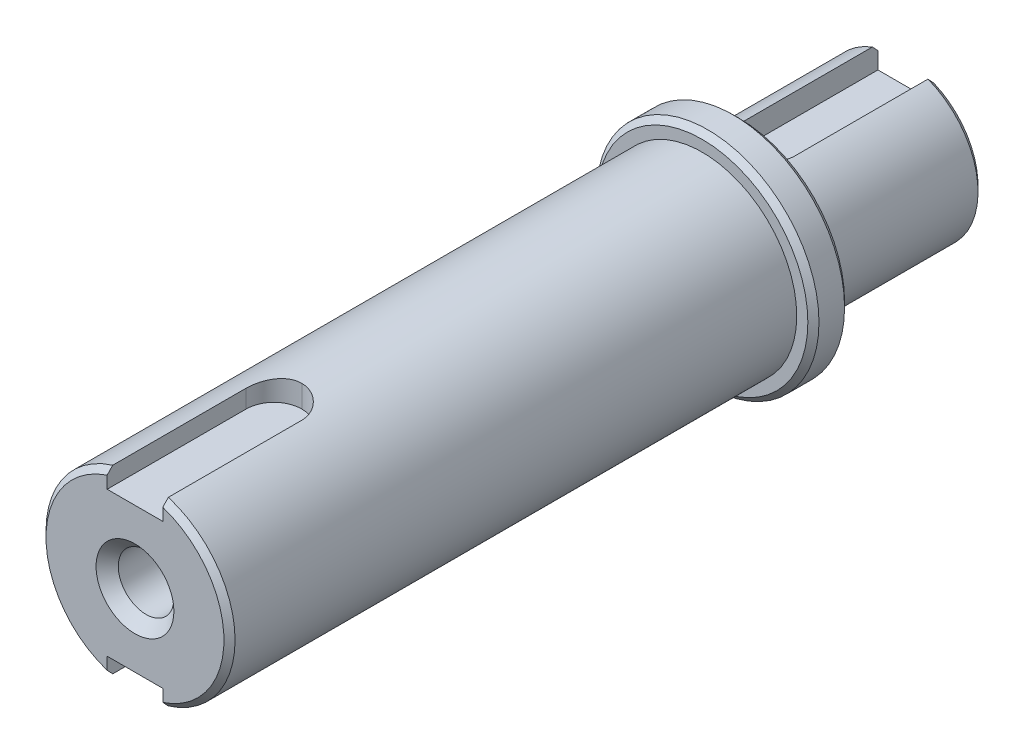
from build123d import *

# Parameters (mm, degrees)
SKETCH_1_R               = 7
EXTRUDE_1_DEPTH          = 15
SKETCH_3_R               = 10
EXTRUDE_2_DEPTH          = 3.3
SKETCH_4_R               = 8.5
EXTRUDE_3_DEPTH          = 51
SKETCH_6_W               = 5
SKETCH_6_H               = 2.626010101
CUT_EXTRUDE_1_DEPTH      = 15
FILLET_1_R               = 2.5
SKETCH_7_R               = 2.5
CUT_EXTRUDE_2_DEPTH      = 15
SKETCH_8_W               = 5
SKETCH_8_H               = 2.5
CUT_EXTRUDE_3_DEPTH      = 15
FILLET_2_R               = 2.5
CHAMFER_1_SIZE           = 1
CHAMFER_2_SIZE           = 0.5
CHAMFER_3_SIZE           = 0.5
PATTERN_CIRCULAR_1_COUNT = 2
FILLET_3_R               = 2.5


with BuildPart() as part:
    # 草图1 → 拉伸1 (new body)
    with BuildSketch(Plane.XY):
        Circle(SKETCH_1_R)
    extrude(amount=EXTRUDE_1_DEPTH)

    # 草图3 → 拉伸2 (add)
    with BuildSketch(Plane.XY.offset(15)):
        Circle(SKETCH_3_R)
    extrude(amount=EXTRUDE_2_DEPTH)

    # 草图4 → 拉伸3 (add)
    with BuildSketch(Plane.XY.offset(18.3)):
        Circle(SKETCH_4_R)
    extrude(amount=EXTRUDE_3_DEPTH)

    # 草图6 → 切除-拉伸1 (cut)
    with BuildSketch(Plane.XY.offset(69.3)):
        with Locations((0, 7.813005051)):
            Rectangle(SKETCH_6_W, SKETCH_6_H)
    cut_extrude_1 = extrude(amount=-CUT_EXTRUDE_1_DEPTH, mode=Mode.SUBTRACT)

    # 圆角1
    fillet_1_edges = [part.edges().sort_by_distance(p)[0] for p in [
        (-2.5, 7.312019202, 54.3),
        (2.5, 7.312019202, 54.3),
    ]]
    fillet(fillet_1_edges, radius=FILLET_1_R - 0.0001)  # a hair under: the kernel refuses the full size

    # 草图7 → 切除-拉伸2 (cut)
    with BuildSketch(Plane.XY.offset(69.3)):
        Circle(SKETCH_7_R)
    extrude(amount=-CUT_EXTRUDE_2_DEPTH, mode=Mode.SUBTRACT)

    # 草图8 → 切除-拉伸3 (cut)
    with BuildSketch(Plane(origin=(0, 0, 0), x_dir=(-1, 0, 0), z_dir=(0, 0, -1))):
        with Locations((0, 5.75)):
            Rectangle(SKETCH_8_W, SKETCH_8_H)
    extrude(amount=-CUT_EXTRUDE_3_DEPTH, mode=Mode.SUBTRACT)

    # 圆角2
    fillet_2_edges = [part.edges().sort_by_distance(p)[0] for p in [
        (-2.5, 5.519174208, 15),
        (2.5, 5.519174208, 15),
    ]]
    fillet(fillet_2_edges, radius=FILLET_2_R - 0.0001)  # a hair under: the kernel refuses the full size

    # 倒角1
    chamfer_1_edges = [part.edges().sort_by_distance(p)[0] for p in [
        (-2.5, 0, 69.3),
    ]]
    chamfer(chamfer_1_edges, length=CHAMFER_1_SIZE)

    # 倒角2
    chamfer_2_edges = [part.edges().sort_by_distance(p)[0] for p in [
        (-5.049752469, -6.837397166, 69.3),
        (-10, 0, 15),
        (-10, 0, 18.3),
    ]]
    chamfer(chamfer_2_edges, length=CHAMFER_2_SIZE)

    # 倒角3
    chamfer_3_edges = [part.edges().sort_by_distance(p)[0] for p in [
        (0, -7, 0),
    ]]
    chamfer(chamfer_3_edges, length=CHAMFER_3_SIZE)

    # 阵列(圆周)1: 切除-拉伸1 ×2 about axis
    pattern_circular_1_axis = Axis((0, 0, 0), (0, 0, 1))
    for i in range(1, PATTERN_CIRCULAR_1_COUNT):
        add(cut_extrude_1.rotate(pattern_circular_1_axis, i * 360 / PATTERN_CIRCULAR_1_COUNT), mode=Mode.SUBTRACT)

    # 圆角3
    fillet_3_edges = [part.edges().sort_by_distance(p)[0] for p in [
        (-2.5, -7.312019202, 54.3),
        (2.5, -7.312019202, 54.3),
    ]]
    fillet(fillet_3_edges, radius=FILLET_3_R - 0.0001)  # a hair under: the kernel refuses the full size


solid = part.part
